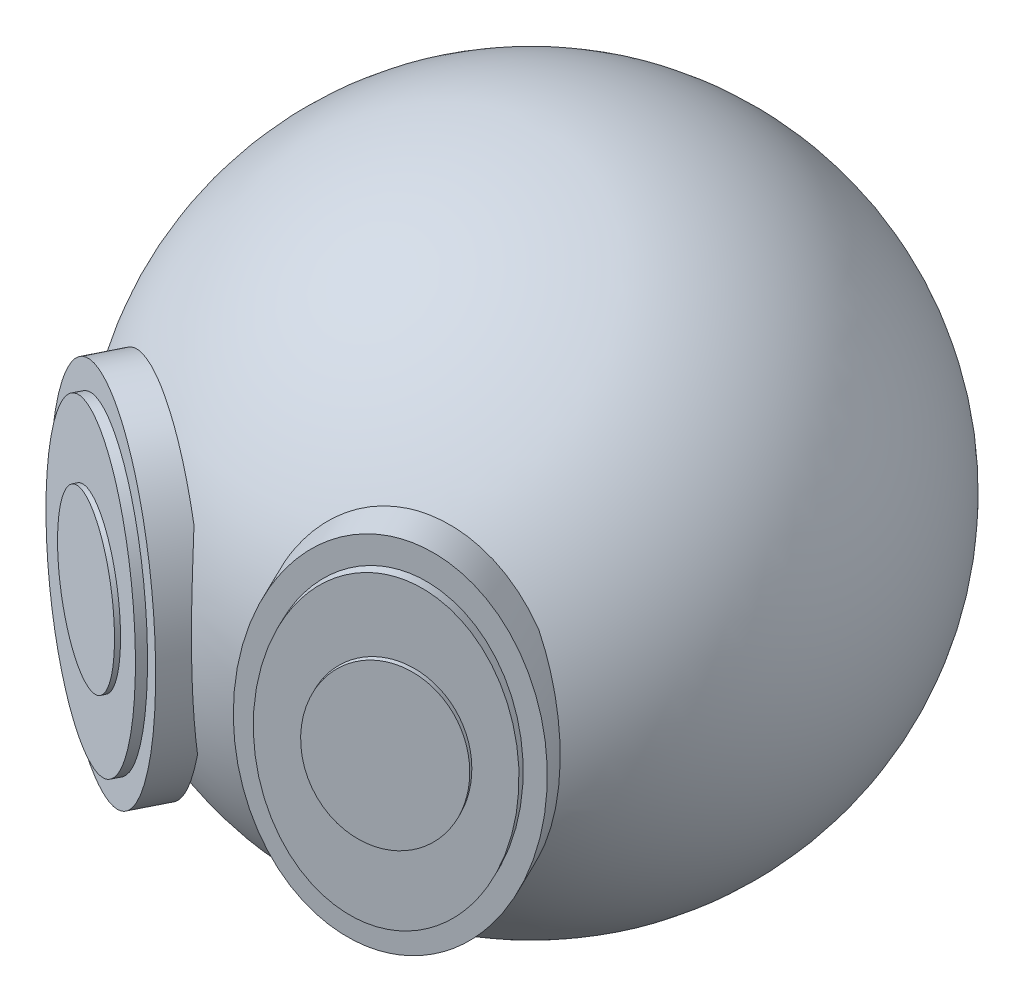
from build123d import *

# Parameters (mm, degrees)
SALIENTE_EXTRUIR1_DEPTH       = 8
SALIENTE_EXTRUIR9_DEPTH       = 1
SALIENTE_EXTRUIR9_DEPTH_BACK  = 3
SALIENTE_EXTRUIR10_DEPTH      = 1
SALIENTE_EXTRUIR10_DEPTH_BACK = 3
CROQUIS9_RX                   = 17
CROQUIS9_RY                   = 11
SALIENTE_EXTRUIR11_DEPTH      = 1
CROQUIS10_RX                  = 17
CROQUIS10_RY                  = 11
SALIENTE_EXTRUIR12_DEPTH      = 1
CROQUIS14_RX                  = 9
CROQUIS14_RY                  = 7
SALIENTE_EXTRUIR13_DEPTH      = 0.5
CROQUIS15_RX                  = 9
CROQUIS15_RY                  = 7
SALIENTE_EXTRUIR14_DEPTH      = 0.5


with BuildPart() as part:
    # Croquis1 → Revolución1 (revolve)
    with BuildSketch(Plane.XY):
        with BuildLine():
            Line((-20.642709128, 127.982928943), (-20.642709128, 57.982928943))
            ThreePointArc((-20.642709128, 57.982928943), (-55.642709128, 92.982928943), (-20.642709128, 127.982928943))
        make_face()
    revolve(axis=Axis((-20.642709128, 127.982928943, 0), (0, -1, 0)))

    # Croquis2 → Saliente-Extruir1 (add)
    with BuildSketch(Plane(origin=(0, 94, 0), x_dir=(1, 0, 0), z_dir=(0, 1, 0))):
        Polygon((-5.736696973, -30.616506839), (-5.602705922, -30.891338575), (-5.111762496, -30.651984757), (-5.245753547, -30.37715302), align=None)
        Polygon((-36.355738212, -30.616506839), (-35.828364621, -30.878789163), (-35.637686782, -30.495391398), (-36.165060373, -30.233109074), align=None)
    extrude(amount=SALIENTE_EXTRUIR1_DEPTH)

    # Croquis7 → Saliente-Extruir9 (add, two sides: drawn at the far end of the back side and taken through both)
    with BuildSketch(Plane(origin=(-19.416528339, 0, 39.041000232), x_dir=(0.895378965722902, 0, 0.44530496038219286), z_dir=(-0.44530496038219286, 0, 0.895378965722902)).offset(-SALIENTE_EXTRUIR9_DEPTH_BACK)):
        with BuildLine():
            add(Edge.make_bspline(
                [(-18.329486074, 112.377946306), (-40.846146572, 112.377946306), (-29.587816323, 82.377946306), (-18.329486074, 52.377946306), (-7.071155824, 82.377946306), (4.187174425, 112.377946306), (-18.329486074, 112.377946306)],
                knots=[0, 0, 0, 2.094395102, 2.094395102, 4.188790205, 4.188790205, 6.283185307, 6.283185307, 6.283185307], degree=2, weights=[1, 0.5, 1, 0.5, 1, 0.5, 1]))
        make_face()
        with BuildLine():
            Line((-18.918480914, 99.364952602), (-18.918480914, 102))
            Line((-18.918480914, 102), (-18.329486074, 102))
            Line((-18.329486074, 102), (-18.329486074, 99.377946306))
            ThreePointArc((-18.329486074, 99.377946306), (-18.62413316, 99.378233709), (-18.918480914, 99.364952602))
        make_face(mode=Mode.SUBTRACT)
    extrude(amount=SALIENTE_EXTRUIR9_DEPTH + SALIENTE_EXTRUIR9_DEPTH_BACK)

    # Croquis8 → Saliente-Extruir10 (add, two sides: drawn at the far end of the back side and taken through both)
    with BuildSketch(Plane(origin=(11.092394979, 0, 22.751834242), x_dir=(0.8988627755120207, 0, -0.438230202974221), z_dir=(0.438230202974221, 0, 0.8988627755120207)).offset(-SALIENTE_EXTRUIR10_DEPTH_BACK)):
        with BuildLine():
            add(Edge.make_bspline(
                [(-18.027398526, 112.634660083), (-40.544059025, 112.634660083), (-29.285728776, 82.634660083), (-18.027398526, 52.634660083), (-6.769068277, 82.634660083), (4.489261972, 112.634660083), (-18.027398526, 112.634660083)],
                knots=[0, 0, 0, 2.094395102, 2.094395102, 4.188790205, 4.188790205, 6.283185307, 6.283185307, 6.283185307], degree=2, weights=[1, 0.5, 1, 0.5, 1, 0.5, 1]))
        make_face()
        with BuildLine():
            ThreePointArc((-18.027398526, 99.634660083), (-18.300276243, 99.650686137), (-18.573581369, 99.655522486))
            Line((-18.573581369, 99.655522486), (-18.573581369, 102))
            Line((-18.573581369, 102), (-18.027398526, 102))
            Line((-18.027398526, 102), (-18.027398526, 99.634660083))
        make_face(mode=Mode.SUBTRACT)
    extrude(amount=SALIENTE_EXTRUIR10_DEPTH + SALIENTE_EXTRUIR10_DEPTH_BACK)

    # Croquis9 → Saliente-Extruir11 (add)
    with BuildSketch(Plane(origin=(-19.861833299, 0, 39.936379198), x_dir=(0.895378965722902, 0, 0.445304960382193), z_dir=(-0.445304960382193, 0, 0.895378965722902))):
        with Locations(Location((-18.329486074, 92.377946306), (0, 0, 90))):
            Ellipse(CROQUIS9_RX, CROQUIS9_RY)
    extrude(amount=SALIENTE_EXTRUIR11_DEPTH)

    # Croquis10 → Saliente-Extruir12 (add)
    with BuildSketch(Plane(origin=(11.530625182, 0, 23.650697017), x_dir=(0.8988627755120205, 0, -0.4382302029742211), z_dir=(0.43823020297422116, 0, 0.8988627755120207))):
        with Locations(Location((-18.027398526, 92.634660083), (0, 0, 90))):
            Ellipse(CROQUIS10_RX, CROQUIS10_RY)
    extrude(amount=SALIENTE_EXTRUIR12_DEPTH)

    # Croquis14 → Saliente-Extruir13 (add)
    with BuildSketch(Plane(origin=(11.968855385, 0, 24.549559793), x_dir=(0.8988627755120205, 0, -0.4382302029742212), z_dir=(0.4382302029742212, 0, 0.8988627755120205))):
        with Locations(Location((-17.934930842, 92.634660083), (0, 0, 90))):
            Ellipse(CROQUIS14_RX, CROQUIS14_RY)
    extrude(amount=SALIENTE_EXTRUIR13_DEPTH)

    # Croquis15 → Saliente-Extruir14 (add)
    with BuildSketch(Plane(origin=(-20.307138259, 0, 40.831758164), x_dir=(0.8953789657229019, 0, 0.4453049603821931), z_dir=(-0.4453049603821931, 0, 0.8953789657229019))):
        with Locations(Location((-17.987894219, 92.377946306), (0, 0, 90))):
            Ellipse(CROQUIS15_RX, CROQUIS15_RY)
    extrude(amount=SALIENTE_EXTRUIR14_DEPTH)


solid = part.part
